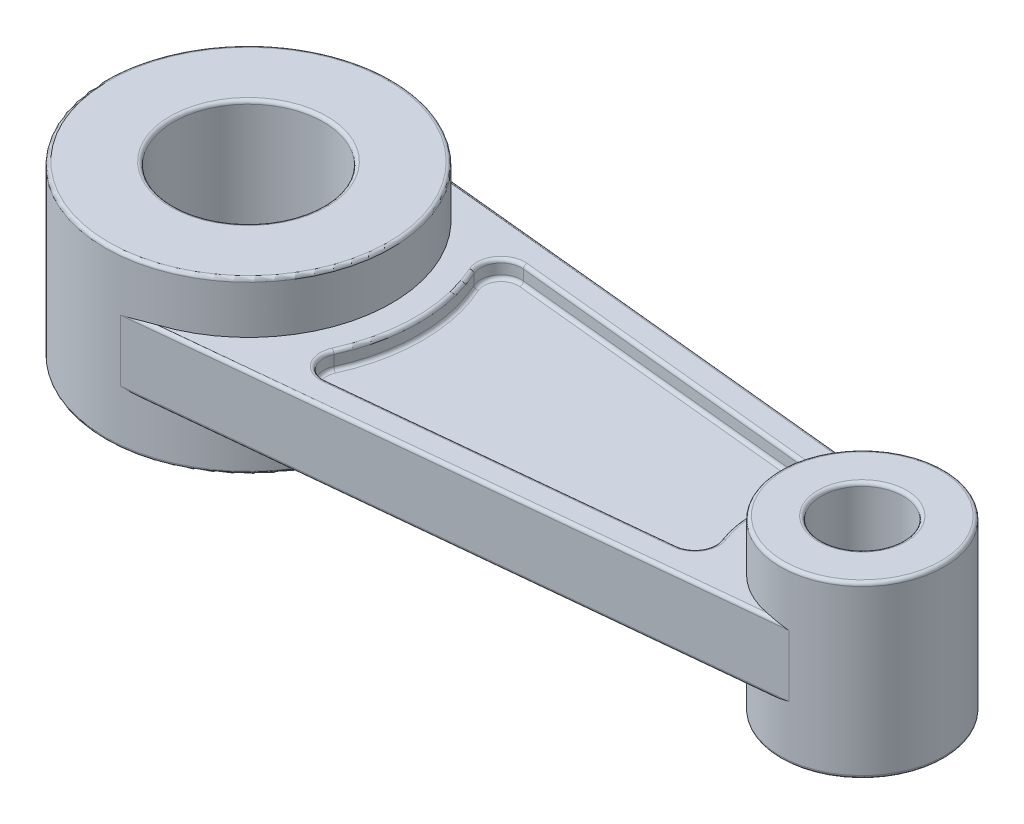
from build123d import *

# Parameters (mm, degrees)
SKETCH1_R           = 21
BOSS_EXTRUDE1_DEPTH = 12.5
SKETCH2_R           = 11
CUT_EXTRUDE1_DEPTH  = 25
SKETCH3_R           = 12
BOSS_EXTRUDE2_DEPTH = 25
SKETCH4_R           = 6
CUT_EXTRUDE2_DEPTH  = 25
BOSS_EXTRUDE3_DEPTH = 5
CUT_EXTRUDE3_DEPTH  = 2.5
FILLET1_R           = 0.5
FILLET2_R           = 0.5


with BuildPart() as part:
    # Sketch1 → Boss-Extrude1 (new, symmetric)
    with BuildSketch(Plane(origin=(0, 0, 0), x_dir=(1, 0, 0), z_dir=(0, 1, 0))):
        with Locations(Location((0, 0, 0), (0, 0, 270))):
            Circle(SKETCH1_R)
    extrude(amount=BOSS_EXTRUDE1_DEPTH, both=True)

    # Sketch2 → Cut-Extrude1 (cut)
    with BuildSketch(Plane(origin=(0, 12.5, 0), x_dir=(1, 0, 0), z_dir=(0, 1, 0))):
        with Locations(Location((0, 0, 0), (0, 0, 270))):
            Circle(SKETCH2_R)
    extrude(amount=-CUT_EXTRUDE1_DEPTH, mode=Mode.SUBTRACT)



with BuildPart() as body_2:
    # Sketch3 → Boss-Extrude2 (new body)
    with BuildSketch(Plane(origin=(0, 12.5, 0), x_dir=(1, 0, 0), z_dir=(0, 1, 0))):
        with Locations(Location((90, 0, 0), (0, 0, 270))):
            Circle(SKETCH3_R)
    extrude(amount=-BOSS_EXTRUDE2_DEPTH)

    # Sketch4 → Cut-Extrude2 (cut)
    with BuildSketch(Plane(origin=(0, 12.5, 0), x_dir=(1, 0, 0), z_dir=(0, 1, 0))):
        with Locations(Location((90, 0, 0), (0, 0, 270))):
            Circle(SKETCH4_R)
    extrude(amount=-CUT_EXTRUDE2_DEPTH, mode=Mode.SUBTRACT)


with BuildPart() as part_1:
    add(part.part)

    add(body_2.part)  # Boss-Extrude3 merges body 2
    # Sketch8 → Boss-Extrude3 (add, symmetric)
    with BuildSketch(Plane(origin=(0, 0, 0), x_dir=(1, 0, 0), z_dir=(0, 1, 0))):
        with BuildLine():
            Line((2.1, 20.894736179), (91.2, 11.939849245))
            ThreePointArc((91.2, 11.939849245), (78, 0), (91.2, -11.939849245))
            Line((91.2, -11.939849245), (2.1, -20.894736179))
            ThreePointArc((2.1, -20.894736179), (21, 0), (2.1, 20.894736179))
        make_face()
    extrude(amount=BOSS_EXTRUDE3_DEPTH, both=True)

    # Sketch9 → Cut-Extrude3 (cut)
    with BuildSketch(Plane(origin=(0, 5, 0), x_dir=(1, 0, 0), z_dir=(0, 1, 0))):
        with BuildLine():
            Line((25.827163115, 14.4899153), (72.561579016, 9.792929775))
            ThreePointArc((72.561579016, 9.792929775), (74.815879609, 8.381355044), (75.062382329, 5.733025232))
            ThreePointArc((75.062382329, 5.733025232), (74, 0), (75.062382329, -5.733025232))
            ThreePointArc((75.062382329, -5.733025232), (74.815879609, -8.381355044), (72.561579016, -9.792929775))
            Line((72.561579016, -9.792929775), (25.827163115, -14.4899153))
            ThreePointArc((25.827163115, -14.4899153), (23.092109925, -13.257241766), (22.792109925, -10.272279454))
            ThreePointArc((22.792109925, -10.272279454), (25, 0), (22.792109925, 10.272279454))
            ThreePointArc((22.792109925, 10.272279454), (23.092109925, 13.257241766), (25.827163115, 14.4899153))
        make_face()
    cut_extrude3 = extrude(amount=-CUT_EXTRUDE3_DEPTH, mode=Mode.SUBTRACT)

    # Mirror1: Cut-Extrude3 across plane
    add(cut_extrude3.mirror(Plane.ZX), mode=Mode.SUBTRACT)

    # Fillet1
    # the kernel refuses this fillet: 0.5 mm, written as the material it takes off along each edge
    with BuildSketch(Plane(origin=(94.931202889, -5, 11.564849245), x_dir=(0, 1, 0), z_dir=(-0.9949874371066201, 0, 0.09999999999999998))) as fillet1_piece_1_section:
        with BuildLine():
            CenterArc((FILLET1_R, FILLET1_R), FILLET1_R, 180, 90)
            Line((0, FILLET1_R), (0, 0))
            Line((0, 0), (FILLET1_R, 0))
        make_face()
    fillet1_piece_1 = extrude(amount=99.54886934, mode=Mode.PRIVATE)
    fillet1_piece_1 = fillet1_piece_1 - Plane(origin=(0, -5, 0), x_dir=(0, 0, 1), z_dir=(0, 1, 0)) * Cylinder(21, 202, mode=Mode.PRIVATE)
    fillet1_piece_1 = fillet1_piece_1 - Plane(origin=(90, -5, 0), x_dir=(0, 0, 1), z_dir=(0, 1, 0)) * Cylinder(12, 202, mode=Mode.PRIVATE)
    add(fillet1_piece_1, mode=Mode.SUBTRACT)
    with BuildSketch(Plane(origin=(-4.118671482, 5, -21.519736179), x_dir=(0, -1, 0), z_dir=(0.9949874371066201, 0, 0.09999999999999996))) as fillet1_piece_2_section:
        with BuildLine():
            CenterArc((FILLET1_R, -FILLET1_R), FILLET1_R, 90, 90)
            Line((0, -FILLET1_R), (0, 0))
            Line((0, 0), (FILLET1_R, 0))
        make_face()
    fillet1_piece_2 = extrude(amount=99.54886934, mode=Mode.PRIVATE)
    fillet1_piece_2 = fillet1_piece_2 - Plane(origin=(0, 5, 0), x_dir=(0, 0, 1), z_dir=(0, 1, 0)) * Cylinder(21, 202, mode=Mode.PRIVATE)
    fillet1_piece_2 = fillet1_piece_2 - Plane(origin=(90, 5, 0), x_dir=(0, 0, 1), z_dir=(0, 1, 0)) * Cylinder(12, 202, mode=Mode.PRIVATE)
    add(fillet1_piece_2, mode=Mode.SUBTRACT)
    with BuildSketch(Plane(origin=(94.931202889, 5, 11.564849245), x_dir=(0, -1, 0), z_dir=(-0.9949874371066201, 0, 0.09999999999999998))) as fillet1_piece_3_section:
        with BuildLine():
            CenterArc((FILLET1_R, -FILLET1_R), FILLET1_R, 90, 90)
            Line((0, -FILLET1_R), (0, 0))
            Line((0, 0), (FILLET1_R, 0))
        make_face()
    fillet1_piece_3 = extrude(amount=99.54886934, mode=Mode.PRIVATE)
    fillet1_piece_3 = fillet1_piece_3 - Plane(origin=(0, 5, 0), x_dir=(0, 0, 1), z_dir=(0, 1, 0)) * Cylinder(21, 202, mode=Mode.PRIVATE)
    fillet1_piece_3 = fillet1_piece_3 - Plane(origin=(90, 5, 0), x_dir=(0, 0, 1), z_dir=(0, 1, 0)) * Cylinder(12, 202, mode=Mode.PRIVATE)
    add(fillet1_piece_3, mode=Mode.SUBTRACT)
    with BuildSketch(Plane(origin=(-4.118671482, -5, -21.519736179), x_dir=(-0.09999999999999994, 0, 0.99498743710662), z_dir=(0.9949874371066201, 0, 0.09999999999999996))) as fillet1_piece_4_section:
        with BuildLine():
            CenterArc((FILLET1_R, -FILLET1_R), FILLET1_R, 90, 90)
            Line((0, -FILLET1_R), (0, 0))
            Line((0, 0), (FILLET1_R, 0))
        make_face()
    fillet1_piece_4 = extrude(amount=99.54886934, mode=Mode.PRIVATE)
    fillet1_piece_4 = fillet1_piece_4 - Plane(origin=(0, -5, 0), x_dir=(0, 0, 1), z_dir=(0, 1, 0)) * Cylinder(21, 202, mode=Mode.PRIVATE)
    fillet1_piece_4 = fillet1_piece_4 - Plane(origin=(90, -5, 0), x_dir=(0, 0, 1), z_dir=(0, 1, 0)) * Cylinder(12, 202, mode=Mode.PRIVATE)
    add(fillet1_piece_4, mode=Mode.SUBTRACT)
    with BuildSketch(Plane(origin=(0, -12.5, 0), x_dir=(0, 0, 1), z_dir=(-1, 0, 0))) as fillet1_piece_5:
        with BuildLine():
            CenterArc((21 - FILLET1_R, FILLET1_R), FILLET1_R, 270, 90)
            Line((21 - FILLET1_R, 0), (21, 0))
            Line((21, 0), (21, FILLET1_R))
        make_face()
    revolve(axis=Axis((0, -12.5, 0), (0, 1, 0)), mode=Mode.SUBTRACT)
    with BuildSketch(Plane(origin=(90, -12.5, 0), x_dir=(0, 0, 1), z_dir=(-1, 0, 0))) as fillet1_piece_6:
        with BuildLine():
            CenterArc((12 - FILLET1_R, FILLET1_R), FILLET1_R, 270, 90)
            Line((12 - FILLET1_R, 0), (12, 0))
            Line((12, 0), (12, FILLET1_R))
        make_face()
    revolve(axis=Axis((90, -12.5, 0), (0, 1, 0)), mode=Mode.SUBTRACT)
    with BuildSketch(Plane(origin=(90, -12.5, 0), x_dir=(0, 0, 1), z_dir=(-1, 0, 0))) as fillet1_piece_7:
        with BuildLine():
            CenterArc((6 + FILLET1_R, FILLET1_R), FILLET1_R, 180, 90)
            Line((6, FILLET1_R), (6, 0))
            Line((6, 0), (6 + FILLET1_R, 0))
        make_face()
    revolve(axis=Axis((90, -12.5, 0), (0, 1, 0)), mode=Mode.SUBTRACT)
    with BuildSketch(Plane(origin=(90, 12.5, 0), x_dir=(0, 0, 1), z_dir=(-1, 0, 0))) as fillet1_piece_8:
        with BuildLine():
            CenterArc((12 - FILLET1_R, -FILLET1_R), FILLET1_R, 0, 90)
            Line((12 - FILLET1_R, 0), (12, 0))
            Line((12, 0), (12, -FILLET1_R))
        make_face()
    revolve(axis=Axis((90, 12.5, 0), (0, 1, 0)), mode=Mode.SUBTRACT)
    with BuildSketch(Plane(origin=(90, 12.5, 0), x_dir=(0, 0, 1), z_dir=(-1, 0, 0))) as fillet1_piece_9:
        with BuildLine():
            CenterArc((6 + FILLET1_R, -FILLET1_R), FILLET1_R, 90, 90)
            Line((6, -FILLET1_R), (6, 0))
            Line((6, 0), (6 + FILLET1_R, 0))
        make_face()
    revolve(axis=Axis((90, 12.5, 0), (0, 1, 0)), mode=Mode.SUBTRACT)
    with BuildSketch(Plane(origin=(0, 12.5, 0), x_dir=(0, 0, 1), z_dir=(-1, 0, 0))) as fillet1_piece_10:
        with BuildLine():
            CenterArc((21 - FILLET1_R, -FILLET1_R), FILLET1_R, 0, 90)
            Line((21 - FILLET1_R, 0), (21, 0))
            Line((21, 0), (21, -FILLET1_R))
        make_face()
    revolve(axis=Axis((0, 12.5, 0), (0, 1, 0)), mode=Mode.SUBTRACT)
    with BuildSketch(Plane(origin=(0, -12.5, 0), x_dir=(0, 0, 1), z_dir=(-1, 0, 0))) as fillet1_piece_11:
        with BuildLine():
            CenterArc((11 + FILLET1_R, FILLET1_R), FILLET1_R, 180, 90)
            Line((11, FILLET1_R), (11, 0))
            Line((11, 0), (11 + FILLET1_R, 0))
        make_face()
    revolve(axis=Axis((0, -12.5, 0), (0, 1, 0)), mode=Mode.SUBTRACT)
    with BuildSketch(Plane(origin=(0, 12.5, 0), x_dir=(0, 0, 1), z_dir=(-1, 0, 0))) as fillet1_piece_12:
        with BuildLine():
            CenterArc((11 + FILLET1_R, -FILLET1_R), FILLET1_R, 90, 90)
            Line((11, -FILLET1_R), (11, 0))
            Line((11, 0), (11 + FILLET1_R, 0))
        make_face()
    revolve(axis=Axis((0, 12.5, 0), (0, 1, 0)), mode=Mode.SUBTRACT)

    # Fillet2
    fillet2_edges = [part_1.edges().sort_by_distance(p)[0] for p in [
        (23.092109925, 5, 13.257241766),
        (25, 5, 0),
        (23.092109925, 2.5, -13.257241766),
        (49.194371066, 5, -12.141422538),
        (74.815879609, 5, -8.381355044),
        (74, 5, 0),
        (74.815879609, 5, 8.381355044),
        (49.194371066, 2.5, 12.141422538),
        (23.092109925, 2.5, 13.257241766),
        (25, 2.5, 0),
        (49.194371066, 2.5, -12.141422538),
        (74.815879609, 2.5, -8.381355044),
        (74, 2.5, 0),
        (74.815879609, 2.5, 8.381355044),
        (49.194371066, 5, 12.141422538),
        (23.092109925, 5, -13.257241766),
        (23.092109925, -2.5, 13.257241766),
        (49.194371066, -5, 12.141422538),
        (74.815879609, -2.5, 8.381355044),
        (74, -2.5, 0),
        (74.815879609, -2.5, -8.381355044),
        (49.194371066, -2.5, -12.141422538),
        (23.092109925, -5, -13.257241766),
        (25, -2.5, 0),
        (49.194371066, -2.5, 12.141422538),
        (23.092109925, -2.5, -13.257241766),
        (23.092109925, -5, 13.257241766),
        (25, -5, 0),
        (49.194371066, -5, -12.141422538),
        (74.815879609, -5, -8.381355044),
        (74, -5, 0),
        (74.815879609, -5, 8.381355044),
    ]]
    fillet(fillet2_edges, radius=FILLET2_R)


solid = part_1.part
